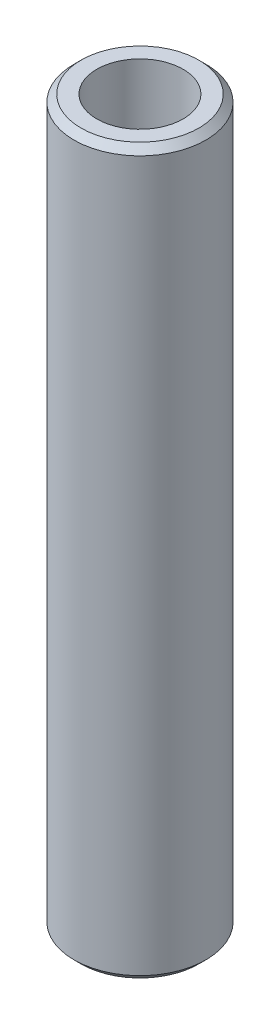
from build123d import *

# Parameters (mm, degrees)
SKETCH1_R           = 12.5
BOSS_EXTRUDE1_DEPTH = 137.390276625
SKETCH2_R           = 8.185857193
CUT_EXTRUDE1_DEPTH  = 139.522879378
CHAMFER1_SIZE       = 1.320060969


with BuildPart() as part:
    # Sketch1 → Boss-Extrude1 (new body)
    with BuildSketch(Plane(origin=(0, 0, 0), x_dir=(1, 0, 0), z_dir=(0, 1, 0))):
        Circle(SKETCH1_R)
    extrude(amount=BOSS_EXTRUDE1_DEPTH)

    # Sketch2 → Cut-Extrude1 (cut, through all)
    with BuildSketch(Plane(origin=(0, 0, 0), x_dir=(1, 0, 0), z_dir=(0, 1, 0))):
        Circle(SKETCH2_R)
    extrude(amount=CUT_EXTRUDE1_DEPTH, mode=Mode.SUBTRACT)

    # Chamfer1
    chamfer1_edges = [part.edges().sort_by_distance(p)[0] for p in [
        (-12.5, 137.390276625, 0),
        (-12.5, 0, 0),
    ]]
    chamfer(chamfer1_edges, length=CHAMFER1_SIZE)


solid = part.part
